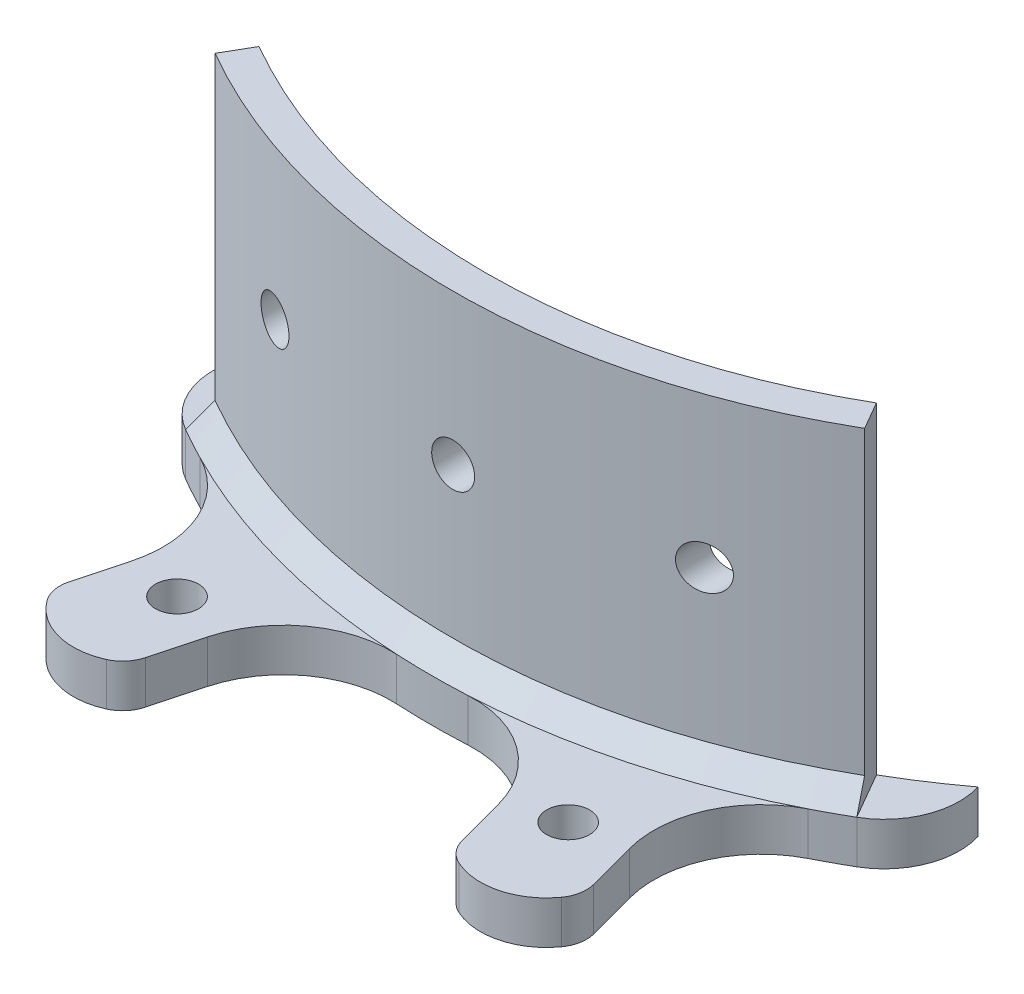
from build123d import *

# Parameters (mm, degrees)
BOSS_EXTRUDE1_DEPTH     = 10
BOSS_EXTRUDE2_DEPTH     = 30
BOSS_EXTRUDE3_DEPTH     = 4
CHAMFER1_SIZE           = 2
CUT_EXTRUDE1_DEPTH      = 78.548774974
CUT_EXTRUDE1_DEPTH_BACK = 78.548774974
SKETCH5_R               = 2
BOSS_EXTRUDE4_START     = -4
SKETCH6_R               = 2
BOSS_EXTRUDE4_DEPTH     = 4
FILLET1_R               = 10
CUT_EXTRUDE2_DEPTH      = 90.553145411
CUT_EXTRUDE2_DEPTH_BACK = 90.553145411
SKETCH7_R               = 57.5


with BuildPart() as part:
    # Sketch1 → Boss-Extrude1 (new body)
    with BuildSketch(Plane(origin=(0, 0, 0), x_dir=(1, 0, 0), z_dir=(0, 1, 0))):
        with BuildLine():
            ThreePointArc((-25.25, -43.734282891), (0, -50.5), (25.25, -43.734282891))
            Line((25.25, -43.734282891), (27.25, -47.198384506))
            ThreePointArc((27.25, -47.198384506), (0, -54.5), (-27.25, -47.198384506))
            Line((-27.25, -47.198384506), (-25.25, -43.734282891))
        make_face()
    extrude(amount=BOSS_EXTRUDE1_DEPTH)



with BuildPart() as body_2:
    # Sketch3 → Boss-Extrude2 (new body)
    with BuildSketch(Plane.XZ):
        with BuildLine():
            Line((-30.25, 52.394536929), (-28.75, 49.796460718))
            ThreePointArc((-28.75, 49.796460718), (0, 57.5), (28.75, 49.796460718))
            Line((28.75, 49.796460718), (30.25, 52.394536929))
            ThreePointArc((30.25, 52.394536929), (0, 60.5), (-30.25, 52.394536929))
        make_face()
    extrude(amount=-BOSS_EXTRUDE2_DEPTH)


with BuildPart() as part_1:
    add(part.part)

    add(body_2.part)  # Boss-Extrude3 merges body 2
    # Sketch4 → Boss-Extrude3 (add)
    with BuildSketch(Plane.XZ):
        with BuildLine():
            ThreePointArc((-24.25, 42.002232084), (0, 48.5), (24.25, 42.002232084))
            ThreePointArc((24.25, 42.002232084), (33.812177826, 44.56440991), (31.25, 54.126587737))
            ThreePointArc((31.25, 54.126587737), (0, 62.5), (-31.25, 54.126587737))
            ThreePointArc((-31.25, 54.126587737), (-33.812177826, 44.56440991), (-24.25, 42.002232084))
        make_face()
    extrude(amount=BOSS_EXTRUDE3_DEPTH)

    # Chamfer1
    chamfer1_edges = [part_1.edges().sort_by_distance(p)[0] for p in [
        (0, 0, 60.5),
        (0, 0, 50.5),
    ]]
    chamfer(chamfer1_edges, length=CHAMFER1_SIZE - 0.0001)  # a hair under: the kernel refuses the full size

    # Sketch5 → Cut-Extrude1 (cut, two sides: drawn at the far end of the back side and taken through both)
    with BuildSketch(Plane.XY.offset(-CUT_EXTRUDE1_DEPTH_BACK)):
        with Locations(Location((0, 16, 0), (0, 0, 180))):
            Circle(SKETCH5_R)
        with Locations(Location((-20, 16, 0), (0, 0, 180))):
            Circle(SKETCH5_R)
        with Locations(Location((20, 16, 0), (0, 0, 180))):
            Circle(SKETCH5_R)
    extrude(amount=CUT_EXTRUDE1_DEPTH + CUT_EXTRUDE1_DEPTH_BACK, mode=Mode.SUBTRACT)

    # Sketch6 → Boss-Extrude4 (add)
    # profile 1 of 2: a face of its own
    with BuildSketch(Plane.XZ.offset(4).offset(BOSS_EXTRUDE4_START)):
        with BuildLine():
            Line((20.953972553, 58.882773663), (24.414654978, 71.798216302))
            ThreePointArc((24.414654978, 71.798216302), (24.468385119, 73.111891055), (23.955219754, 74.322382523))
            ThreePointArc((23.955219754, 74.322382523), (20.546663808, 76.681193258), (16.415362401, 76.342681212))
            ThreePointArc((16.415362401, 76.342681212), (15.365702425, 75.550947532), (14.755396715, 74.386406753))
            Line((14.755396715, 74.386406753), (11.29471429, 61.470964114))
            ThreePointArc((11.29471429, 61.470964114), (16.176190319, 60.370364143), (20.953972553, 58.882773663))
        make_face()
        with Locations(Location((18.213190451, 67.972552131, 0), (0, 0, 270))):
            Circle(SKETCH6_R, mode=Mode.SUBTRACT)
    # profile 2 of 2: a face of its own
    with BuildSketch(Plane.XZ.offset(4).offset(BOSS_EXTRUDE4_START)):
        with BuildLine():
            Line((-20.953972553, 58.882773663), (-24.414654978, 71.798216302))
            ThreePointArc((-24.414654978, 71.798216302), (-24.468385119, 73.111891055), (-23.955219754, 74.322382523))
            ThreePointArc((-23.955219754, 74.322382523), (-20.546663808, 76.681193258), (-16.415362401, 76.342681212))
            ThreePointArc((-16.415362401, 76.342681212), (-15.365702425, 75.550947532), (-14.755396715, 74.386406753))
            Line((-14.755396715, 74.386406753), (-11.29471429, 61.470964114))
            ThreePointArc((-11.29471429, 61.470964114), (-16.176190319, 60.370364143), (-20.953972553, 58.882773663))
        make_face()
        with Locations(Location((-18.213190451, 67.972552131, 0), (0, 0, 270))):
            Circle(SKETCH6_R, mode=Mode.SUBTRACT)
    extrude(amount=BOSS_EXTRUDE4_DEPTH)

    # Fillet1
    fillet1_edges = [part_1.edges().sort_by_distance(p)[0] for p in [
        (-11.29471429, -2, 61.470964114),
        (-20.953972553, -2, 58.882773663),
        (20.953972553, -2, 58.882773663),
        (11.29471429, -2, 61.470964114),
    ]]
    fillet(fillet1_edges, radius=FILLET1_R)

    # Sketch7 → Cut-Extrude2 (cut, two sides: drawn at the far end of the back side and taken through both)
    with BuildSketch(Plane(origin=(0, 0, 0), x_dir=(1, 0, 0), z_dir=(0, 1, 0)).offset(-CUT_EXTRUDE2_DEPTH_BACK)):
        Circle(SKETCH7_R)
    extrude(amount=CUT_EXTRUDE2_DEPTH + CUT_EXTRUDE2_DEPTH_BACK, mode=Mode.SUBTRACT)


solid = part_1.part
